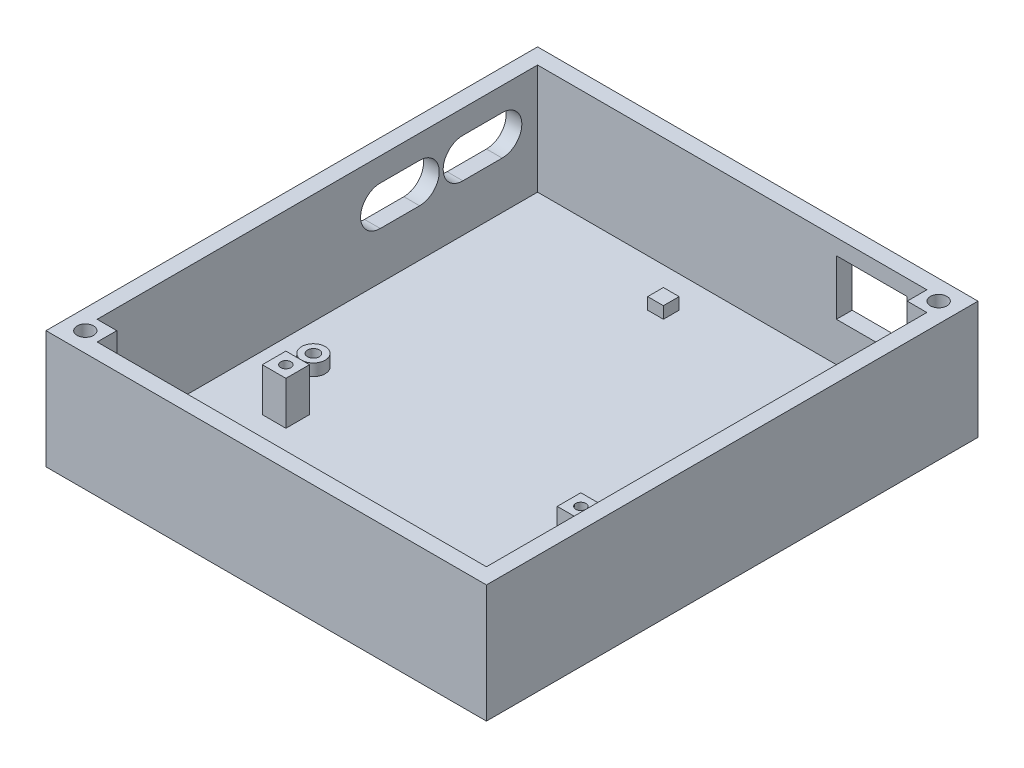
from build123d import *

# Parameters (mm, degrees)
SKETCH1_W           = 112
SKETCH1_H           = 125
BOSS_EXTRUDE1_DEPTH = 2
SKETCH2_W           = 112
SKETCH2_H           = 125
SKETCH2_R           = 2.1
BOSS_EXTRUDE2_DEPTH = 10
SKETCH3_W           = 6
SKETCH3_H           = 6
SKETCH3_R           = 1.3
BOSS_EXTRUDE3_DEPTH = 11
SKETCH5_R           = 3
SKETCH5_R_2         = 1.5
SKETCH5_W           = 4
SKETCH5_H           = 4
BOSS_EXTRUDE4_DEPTH = 3
SKETCH6_W           = 6
SKETCH6_H           = 6
SKETCH6_R           = 1.3
BOSS_EXTRUDE5_DEPTH = 6.3
SKETCH7_W           = 112
SKETCH7_H           = 125
SKETCH7_R           = 2.1
BOSS_EXTRUDE6_DEPTH = 18
CUT_EXTRUDE1_REACH  = 133.72
CUT_EXTRUDE2_REACH  = 142.218
SKETCH10_W          = 18
SKETCH10_H          = 14


with BuildPart() as part:
    # Sketch1 → Boss-Extrude1 (new body)
    with BuildSketch(Plane(origin=(0, 0, 0), x_dir=(1, 0, 0), z_dir=(0, 1, 0))):
        Rectangle(SKETCH1_W, SKETCH1_H)
    extrude(amount=BOSS_EXTRUDE1_DEPTH)

    # Sketch2 → Boss-Extrude2 (add)
    with BuildSketch(Plane(origin=(0, 2, 0), x_dir=(1, 0, 0), z_dir=(0, 1, 0))):
        Rectangle(SKETCH2_W, SKETCH2_H)
        Polygon((47, 53.5), (52, 53.5), (52, -58.5), (-47, -58.5), (-47, -53.5), (-52, -53.5), (-52, 58.5), (47, 58.5), align=None, mode=Mode.SUBTRACT)
        with Locations((51, 57.5)):
            Circle(SKETCH2_R, mode=Mode.SUBTRACT)
        with Locations((-51, -57.5)):
            Circle(SKETCH2_R, mode=Mode.SUBTRACT)
    extrude(amount=BOSS_EXTRUDE2_DEPTH)

    # Sketch3 → Boss-Extrude3 (add)
    # profile 1 of 4: a face of its own
    with BuildSketch(Plane(origin=(0, 2, 0), x_dir=(1, 0, 0), z_dir=(0, 1, 0))):
        with Locations((-35, -22.5)):
            Rectangle(SKETCH3_W, SKETCH3_H)
        with Locations((-35, -22.5)):
            Circle(SKETCH3_R, mode=Mode.SUBTRACT)
    # profile 2 of 4: a face of its own
    with BuildSketch(Plane(origin=(0, 2, 0), x_dir=(1, 0, 0), z_dir=(0, 1, 0))):
        with Locations((40, -22.5)):
            Rectangle(SKETCH3_W, SKETCH3_H)
        with Locations((40, -22.5)):
            Circle(SKETCH3_R, mode=Mode.SUBTRACT)
    # profile 3 of 4: a face of its own
    with BuildSketch(Plane(origin=(0, 2, 0), x_dir=(1, 0, 0), z_dir=(0, 1, 0))):
        with Locations((-35, -53.5)):
            Rectangle(SKETCH3_W, SKETCH3_H)
        with Locations((-35, -53.5)):
            Circle(SKETCH3_R, mode=Mode.SUBTRACT)
    # profile 4 of 4: a face of its own
    with BuildSketch(Plane(origin=(0, 2, 0), x_dir=(1, 0, 0), z_dir=(0, 1, 0))):
        with Locations((40, -53.5)):
            Rectangle(SKETCH3_W, SKETCH3_H)
        with Locations((40, -53.5)):
            Circle(SKETCH3_R, mode=Mode.SUBTRACT)
    extrude(amount=BOSS_EXTRUDE3_DEPTH)

    # Sketch5 → Boss-Extrude4 (add)
    # profile 1 of 3: a face of its own
    with BuildSketch(Plane(origin=(0, 2, 0), x_dir=(1, 0, 0), z_dir=(0, 1, 0))):
        with Locations((-42, -8.5)):
            Circle(SKETCH5_R)
        with Locations((-42, -8.5)):
            Circle(SKETCH5_R_2, mode=Mode.SUBTRACT)
    # profile 2 of 3: a face of its own
    with BuildSketch(Plane(origin=(0, 2, 0), x_dir=(1, 0, 0), z_dir=(0, 1, 0))):
        with Locations((38, -8.5)):
            Circle(SKETCH5_R)
        with Locations((38, -8.5)):
            Circle(SKETCH5_R_2, mode=Mode.SUBTRACT)
    # profile 3 of 3: a face of its own
    with BuildSketch(Plane(origin=(0, 2, 0), x_dir=(1, 0, 0), z_dir=(0, 1, 0))):
        with Locations((-10, 48.5)):
            Rectangle(SKETCH5_W, SKETCH5_H)
    extrude(amount=BOSS_EXTRUDE4_DEPTH)

    # Sketch6 → Boss-Extrude5 (add)
    # profile 1 of 3: a face of its own
    with BuildSketch(Plane(origin=(0, 13, 0), x_dir=(1, 0, 0), z_dir=(0, 1, 0))):
        with Locations((-35, -53.5)):
            Rectangle(SKETCH6_W, SKETCH6_H)
        with Locations((-35, -53.5)):
            Circle(SKETCH6_R, mode=Mode.SUBTRACT)
    # profile 2 of 3: a face of its own
    with BuildSketch(Plane(origin=(0, 13, 0), x_dir=(1, 0, 0), z_dir=(0, 1, 0))):
        with Locations((40, -22.5)):
            Rectangle(SKETCH6_W, SKETCH6_H)
        with Locations((40, -22.5)):
            Circle(SKETCH6_R, mode=Mode.SUBTRACT)
    # profile 3 of 3: a face of its own
    with BuildSketch(Plane(origin=(0, 13, 0), x_dir=(1, 0, 0), z_dir=(0, 1, 0))):
        with Locations((40, -53.5)):
            Rectangle(SKETCH6_W, SKETCH6_H)
        with Locations((40, -53.5)):
            Circle(SKETCH6_R, mode=Mode.SUBTRACT)
    extrude(amount=BOSS_EXTRUDE5_DEPTH)

    # Sketch7 → Boss-Extrude6 (add)
    with BuildSketch(Plane(origin=(0, 12, 0), x_dir=(1, 0, 0), z_dir=(0, 1, 0))):
        Rectangle(SKETCH7_W, SKETCH7_H)
        with Locations((-51, -57.5)):
            Circle(SKETCH7_R, mode=Mode.SUBTRACT)
        Polygon((47, 58.5), (47, 53.5), (52, 53.5), (52, -58.5), (-47, -58.5), (-47, -53.5), (-52, -53.5), (-52, 58.5), align=None, mode=Mode.SUBTRACT)
        with Locations((51, 57.5)):
            Circle(SKETCH7_R, mode=Mode.SUBTRACT)
    extrude(amount=BOSS_EXTRUDE6_DEPTH)

    # Sketch9 → Cut-Extrude1 (cut, up to next)
    with BuildSketch(Plane.ZY.offset(56), mode=Mode.PRIVATE) as cut_extrude1_sk1:
        with BuildLine():
            Line((-49.5, 24), (-39.5, 24))
            ThreePointArc((-39.5, 24), (-34.5, 19), (-39.5, 14))
            Line((-39.5, 14), (-49.5, 14))
            ThreePointArc((-49.5, 14), (-54.5, 19), (-49.5, 24))
        make_face()
    cut_extrude1_tool1 = extrude(cut_extrude1_sk1.sketch, amount=-CUT_EXTRUDE1_REACH, mode=Mode.PRIVATE) & part.part
    # Sketch9 → Cut-Extrude1 (cut, up to next)
    with BuildSketch(Plane.ZY.offset(56), mode=Mode.PRIVATE) as cut_extrude1_sk2:
        with BuildLine():
            Line((-28.5, 24), (-18.5, 24))
            ThreePointArc((-18.5, 24), (-13.5, 19), (-18.5, 14))
            Line((-18.5, 14), (-28.5, 14))
            ThreePointArc((-28.5, 14), (-33.5, 19), (-28.5, 24))
        make_face()
    cut_extrude1_tool2 = extrude(cut_extrude1_sk2.sketch, amount=-CUT_EXTRUDE1_REACH, mode=Mode.PRIVATE) & part.part
    add(cut_extrude1_tool1.solids().sort_by_distance((-56, 19, -44.5))[0], mode=Mode.SUBTRACT)
    add(cut_extrude1_tool2.solids().sort_by_distance((-56, 19, -23.5))[0], mode=Mode.SUBTRACT)

    # Sketch10 → Cut-Extrude2 (cut, up to next)
    with BuildSketch(Plane(origin=(0, 0, -62.5), x_dir=(-1, 0, 0), z_dir=(0, 0, -1)), mode=Mode.PRIVATE) as cut_extrude2_sk1:
        with Locations((-33, 19)):
            Rectangle(SKETCH10_W, SKETCH10_H)
    cut_extrude2_tool1 = extrude(cut_extrude2_sk1.sketch, amount=-CUT_EXTRUDE2_REACH, mode=Mode.PRIVATE) & part.part
    add(cut_extrude2_tool1.solids().sort_by_distance((33, 19, -62.5))[0], mode=Mode.SUBTRACT)


solid = part.part
